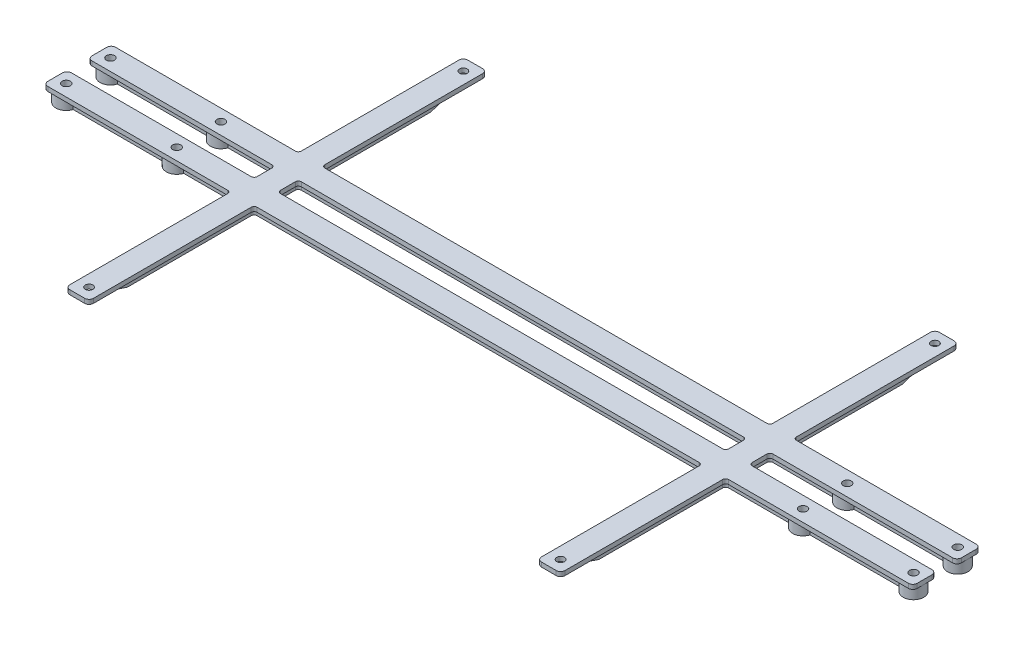
from build123d import *
from build123d.topology import SkipClean

# Parameters (mm, degrees)
EXTRUDE_1_DEPTH             = 2
SKETCH_3_W                  = 590
SKETCH_3_H                  = 3
EXTRUDE_3_DEPTH             = 8
SKETCH_4_R                  = 3.5
EXTRUDE_4_DEPTH             = 3
SKETCH_5_R                  = 3.5
EXTRUDE_5_DEPTH             = 3
FILLET_3_R                  = 3
SKETCH_6_R                  = 1.6
CUT_EXTRUDE_1_DEPTH         = 296.513536069
FILLET_4_R                  = 3
SKETCH_7_W                  = 8
SKETCH_7_H                  = 230
EXTRUDE_6_DEPTH             = 3
SKETCH_8_W                  = 4
SKETCH_8_H                  = 230
EXTRUDE_7_DEPTH             = 8
CUT_EXTRUDE_2_DEPTH         = 476.197853531
CUT_EXTRUDE_3_DEPTH         = 476.197853531
SKETCH_14_R                 = 2.6
CUT_EXTRUDE_6_DEPTH         = 323.56162202
MIRROR_7_COPY_1_SKETCH_R    = 2.6
MIRROR_7_COPY_1_DEPTH       = 323.56162202
SKETCH_16_R                 = 3
CUT_EXTRUDE_8_DEPTH         = 8
MIRROR_10_COPY_1_SKETCH_R   = 3
MIRROR_10_COPY_1_DEPTH      = 8
SKETCH_19_R                 = 2.6
CUT_EXTRUDE_11_DEPTH        = 48
MIRROR_12_COPY_1_SKETCH_R   = 2.6
MIRROR_12_COPY_1_DEPTH      = 48
SKETCH_20_W                 = 16
SKETCH_20_H                 = 3
EXTRUDE_9_DEPTH             = 20
MIRROR_14_COPY_1_SKETCH_W   = 16
MIRROR_14_COPY_1_SKETCH_H   = 3
MIRROR_14_COPY_1_DEPTH      = 20
SKETCH_21_R                 = 2.6
CUT_EXTRUDE_13_DEPTH        = 20
MIRROR_18_COPY_1_SKETCH_R   = 2.6
MIRROR_18_COPY_1_DEPTH      = 20
SKETCH_22_W                 = 304
SKETCH_22_H                 = 20.458635095
SKETCH_22_H_2               = 15.75983919
SKETCH_22_W_2               = 40.975841219
SKETCH_22_H_3               = 20.632120514
SKETCH_22_W_3               = 38.050492137
SKETCH_22_H_4               = 24.245894183
CUT_EXTRUDE_14_DEPTH        = 332.04229337
FILLET_14_R                 = 3
FILLET_15_R                 = 2
FILLET_16_R                 = 2
EXTRUDE_START               = -8
SKETCH_23_R                 = 7
SKETCH_23_R_2               = 2.6
EXTRUDE_10_DEPTH            = 8
CUT_EXTRUDE_START           = -8
CUT_EXTRUDE_15_DEPTH        = 8
PATTERN_LINEAR_1_COUNT      = 2
PATTERN_LINEAR_1_PITCH      = 75
MIRROR_START                = -8
MIRROR_19_COPY_1_SKETCH_R   = 7
MIRROR_19_COPY_1_SKETCH_R_2 = 2.6
MIRROR_19_COPY_1_DEPTH      = 8
MIRROR_20_COPY_1_SKETCH_R   = 7
MIRROR_20_COPY_1_SKETCH_R_2 = 2.6
MIRROR_20_COPY_1_DEPTH      = 8
MIRROR_20_COPY_2_SKETCH_R   = 7
MIRROR_20_COPY_2_SKETCH_R_2 = 2.6
MIRROR_20_COPY_2_DEPTH      = 8
MIRROR_20_COPY_3_DEPTH      = 8
MIRROR_20_COPY_4_SKETCH_R   = 7
MIRROR_20_COPY_4_SKETCH_R_2 = 2.6
MIRROR_20_COPY_4_DEPTH      = 8
HOLE_WIZARD_1_AT_2_COUNT    = 2
HOLE_WIZARD_1_AT_2_PITCH    = 75
HOLE_WIZARD_1_AT_3_COUNT    = 2
HOLE_WIZARD_1_AT_3_PITCH    = 80.777472107
HOLE_WIZARD_1_AT_4_COUNT    = 2
HOLE_WIZARD_1_AT_4_PITCH    = 30


with BuildPart() as part:
    # 草图1 → 凸台-拉伸1 (new, symmetric)
    with BuildSketch(Plane.XY):
        Polygon((-295, 0), (295, 0), (295, -3), (285, -8), (-285, -8), (-295, -3), align=None)
    extrude_1 = extrude(amount=EXTRUDE_1_DEPTH, both=True)

    # 草图3 → 凸台-拉伸3 (add, symmetric)
    with BuildSketch(Plane.XY):
        with Locations((0, 1.5)):
            Rectangle(SKETCH_3_W, SKETCH_3_H)
    extrude_3 = extrude(amount=EXTRUDE_3_DEPTH, both=True)

    # 草图4 → 凸台-拉伸4 (add)
    with BuildSketch(Plane(origin=(0, 3, 0), x_dir=(1, 0, 0), z_dir=(0, 1, 0))):
        with Locations((275, 10)):
            Circle(SKETCH_4_R)
        with Locations((275, -10)):
            Circle(SKETCH_4_R)
        with Locations((-275, -10)):
            Circle(SKETCH_4_R)
        with Locations((-275, 10)):
            Circle(SKETCH_4_R)
    extrude_4 = extrude(amount=-EXTRUDE_4_DEPTH)

    # 草图5 → 凸台-拉伸5 (add)
    with BuildSketch(Plane(origin=(0, 3, 0), x_dir=(1, 0, 0), z_dir=(0, 1, 0))):
        with Locations((140, 10)):
            Circle(SKETCH_5_R)
        with Locations((-140, 10)):
            Circle(SKETCH_5_R)
    extrude_5 = extrude(amount=-EXTRUDE_5_DEPTH)

    # 圆角3
    fillet_3_edges = [part.edges().sort_by_distance(p)[0] for p in [
        (142.872281323, 1.5, -8),
        (137.127718677, 1.5, -8),
        (-137.127718677, 1.5, -8),
        (-142.872281323, 1.5, -8),
    ]]
    fillet(fillet_3_edges, radius=FILLET_3_R)

    # 草图6 → 切除-拉伸1 (cut, through all)
    with BuildSketch(Plane(origin=(0, 3, 0), x_dir=(1, 0, 0), z_dir=(0, 1, 0))):
        with Locations(Location((275, 10, 0), (0, 0, 180))):
            Circle(SKETCH_6_R)
        with Locations(Location((275, -10, 0), (0, 0, 180))):
            Circle(SKETCH_6_R)
        with Locations(Location((140, 10, 0), (0, 0, 180))):
            Circle(SKETCH_6_R)
        with Locations((140, -10)):
            Circle(SKETCH_6_R)
        with Locations(Location((-140, 10, 0), (0, 0, 180))):
            Circle(SKETCH_6_R)
        with Locations((-140, -10)):
            Circle(SKETCH_6_R)
        with Locations(Location((-275, 10, 0), (0, 0, 180))):
            Circle(SKETCH_6_R)
        with Locations(Location((-275, -10, 0), (0, 0, 180))):
            Circle(SKETCH_6_R)
    cut_extrude_1 = extrude(amount=-CUT_EXTRUDE_1_DEPTH, mode=Mode.SUBTRACT)

    # 圆角4
    fillet_4_edges = [part.edges().sort_by_distance(p)[0] for p in [
        (295, 1.5, -8),
        (-295, 1.5, -8),
        (295, 1.5, 8),
        (-295, 1.5, 8),
    ]]
    fillet(fillet_4_edges, radius=FILLET_4_R)

    # 草图7 → 凸台-拉伸6 (add)
    with BuildSketch(Plane(origin=(0, 0, 0), x_dir=(1, 0, 0), z_dir=(0, 1, 0))):
        with Locations((-156, -15)):
            Rectangle(SKETCH_7_W, SKETCH_7_H)
        with Locations((-164, -15)):
            Rectangle(SKETCH_7_W, SKETCH_7_H)
    extrude_6 = extrude(amount=EXTRUDE_6_DEPTH)

    # 镜向1: 凸台-拉伸3, 凸台-拉伸4, 凸台-拉伸5, 切除-拉伸1 across plane
    add(extrude_3.mirror(Plane.XY.offset(15)))
    add(extrude_4.mirror(Plane.XY.offset(15)))
    add(extrude_5.mirror(Plane.XY.offset(15)))
    add(cut_extrude_1.mirror(Plane.XY.offset(15)), mode=Mode.SUBTRACT)

    # 镜向2: 凸台-拉伸1 across plane
    add(extrude_1.mirror(Plane.XY.offset(15)))

    # 草图8 → 凸台-拉伸7 (add)
    with BuildSketch(Plane.XZ):
        with Locations((-160, 15)):
            Rectangle(SKETCH_8_W, SKETCH_8_H)
    extrude_7 = extrude(amount=EXTRUDE_7_DEPTH)

    # 草图9 → 切除-拉伸2 (cut, through all)
    with BuildSketch(Plane.ZY.offset(162)):
        Polygon((130, -4), (118, -8), (130, -8), align=None)
    extrude(amount=-CUT_EXTRUDE_2_DEPTH, mode=Mode.SUBTRACT)

    # 镜向3: 凸台-拉伸6, 凸台-拉伸7 across plane
    add(extrude_6.mirror(Plane(origin=(0, 0, 0), x_dir=(0, 0, 1), z_dir=(1, 0, 0))))
    add(extrude_7.mirror(Plane(origin=(0, 0, 0), x_dir=(0, 0, 1), z_dir=(1, 0, 0))))

    # 草图11 → 切除-拉伸3 (cut, through all)
    with BuildSketch(Plane.ZY.offset(162)):
        Polygon((118, -8), (130, -4), (130, -8), align=None)
        Polygon((-100, -8), (-88, -8), (-100, -4), align=None)
    extrude(amount=-CUT_EXTRUDE_3_DEPTH, mode=Mode.SUBTRACT)

    # 草图14 → 切除-拉伸6 (cut, through all)
    with BuildSketch(Plane(origin=(0, 3, 0), x_dir=(1, 0, 0), z_dir=(0, 1, 0))):
        with Locations(Location((287.5, 0, 0), (0, 0, 180))):
            Circle(SKETCH_14_R)
    cut_extrude_6 = extrude(amount=-CUT_EXTRUDE_6_DEPTH, mode=Mode.SUBTRACT)

    # 镜向6: 切除-拉伸6 across plane
    add(cut_extrude_6.mirror(Plane.XY.offset(15)), mode=Mode.SUBTRACT)

    # 镜向7: 切除-拉伸6 across plane
    add(cut_extrude_6.mirror(Plane(origin=(0, 0, 0), x_dir=(0, 0, 1), z_dir=(1, 0, 0))), mode=Mode.SUBTRACT)

    # 镜向7 copy 1 sketch → 镜向7 copy 1 (cut, through all)
    with BuildSketch(Plane(origin=(0, 3, 30), x_dir=(-1, 0, 0), z_dir=(0, 1, 0))):
        with Locations(Location((287.5, 0, 0), (0, 0, 180))):
            Circle(MIRROR_7_COPY_1_SKETCH_R)
    extrude(amount=-MIRROR_7_COPY_1_DEPTH, mode=Mode.SUBTRACT)

    # 草图16 → 切除-拉伸8 (cut)
    with BuildSketch(Plane.XZ.offset(8)):
        with Locations((-212.5, 0)):
            Circle(SKETCH_16_R)
    cut_extrude_8 = extrude(amount=-CUT_EXTRUDE_8_DEPTH, mode=Mode.SUBTRACT)

    # 镜向9: 切除-拉伸8 across plane
    add(cut_extrude_8.mirror(Plane.XY.offset(15)), mode=Mode.SUBTRACT)

    # 镜向10: 切除-拉伸8 across plane
    add(cut_extrude_8.mirror(Plane(origin=(0, 0, 0), x_dir=(0, 0, 1), z_dir=(1, 0, 0))), mode=Mode.SUBTRACT)

    # 镜向10 copy 1 sketch → 镜向10 copy 1 (cut)
    with BuildSketch(Plane(origin=(0, -8, 30), x_dir=(-1, 0, 0), z_dir=(0, -1, 0))):
        with Locations((-212.5, 0)):
            Circle(MIRROR_10_COPY_1_SKETCH_R)
    extrude(amount=-MIRROR_10_COPY_1_DEPTH, mode=Mode.SUBTRACT)

    # 草图19 → 切除-拉伸11 (cut)
    with BuildSketch(Plane.XZ):
        with Locations((212.5, 30)):
            Circle(SKETCH_19_R)
    cut_extrude_11 = extrude(amount=-CUT_EXTRUDE_11_DEPTH, mode=Mode.SUBTRACT)

    # 镜向11: 切除-拉伸11 across plane
    add(cut_extrude_11.mirror(Plane.XY.offset(15)), mode=Mode.SUBTRACT)

    # 镜向12: 切除-拉伸11 across plane
    add(cut_extrude_11.mirror(Plane(origin=(0, 0, 0), x_dir=(0, 0, 1), z_dir=(1, 0, 0))), mode=Mode.SUBTRACT)

    # 镜向12 copy 1 sketch → 镜向12 copy 1 (cut)
    with BuildSketch(Plane(origin=(0, 0, 30), x_dir=(-1, 0, 0), z_dir=(0, -1, 0))):
        with Locations((212.5, 30)):
            Circle(MIRROR_12_COPY_1_SKETCH_R)
    extrude(amount=-MIRROR_12_COPY_1_DEPTH, mode=Mode.SUBTRACT)

    # 草图20 → 凸台-拉伸9 (add)
    with BuildSketch(Plane.XY.offset(130)):
        with Locations((-160, 1.5)):
            Rectangle(SKETCH_20_W, SKETCH_20_H)
    extrude_9 = extrude(amount=EXTRUDE_9_DEPTH)

    # 镜向13: 凸台-拉伸9 across plane
    add(extrude_9.mirror(Plane(origin=(0, 0, 0), x_dir=(0, 0, 1), z_dir=(1, 0, 0))))

    # 镜向14: 凸台-拉伸9 across plane
    add(extrude_9.mirror(Plane.XY.offset(15)))

    # 镜向14 copy 1 sketch → 镜向14 copy 1 (add)
    with BuildSketch(Plane(origin=(0, 0, -100), x_dir=(-1, 0, 0), z_dir=(0, 0, -1))):
        with Locations((-160, 1.5)):
            Rectangle(MIRROR_14_COPY_1_SKETCH_W, MIRROR_14_COPY_1_SKETCH_H)
    extrude(amount=MIRROR_14_COPY_1_DEPTH)

    # 草图21 → 切除-拉伸13 (cut)
    with BuildSketch(Plane.XZ):
        with Locations((-160, 142)):
            Circle(SKETCH_21_R)
    cut_extrude_13 = extrude(amount=-CUT_EXTRUDE_13_DEPTH, mode=Mode.SUBTRACT)

    # 镜向17: 切除-拉伸13 across plane
    add(cut_extrude_13.mirror(Plane(origin=(0, 0, 0), x_dir=(0, 0, 1), z_dir=(1, 0, 0))), mode=Mode.SUBTRACT)

    # 镜向18: 切除-拉伸13 across plane
    add(cut_extrude_13.mirror(Plane.XY.offset(15)), mode=Mode.SUBTRACT)

    # 镜向18 copy 1 sketch → 镜向18 copy 1 (cut)
    with BuildSketch(Plane(origin=(0, 0, 30), x_dir=(-1, 0, 0), z_dir=(0, -1, 0))):
        with Locations((-160, 142)):
            Circle(MIRROR_18_COPY_1_SKETCH_R)
    extrude(amount=-MIRROR_18_COPY_1_DEPTH, mode=Mode.SUBTRACT)

    # 草图22 → 切除-拉伸14 (cut, through all)
    with BuildSketch(Plane.XZ):
        with Locations((0, -18.229317548)):
            Rectangle(SKETCH_22_W, SKETCH_22_H)
        with Locations((0, 45.879919595)):
            Rectangle(SKETCH_22_W, SKETCH_22_H_2)
        with Locations((-274.51207939, 48.316060257)):
            Rectangle(SKETCH_22_W_2, SKETCH_22_H_3)
        Polygon((-289.685252837, -8), (-263.176120972, -8), (-265.069630391, -21.546038758), (-289.685252837, -21.546038758), align=None)
        with Locations((272.328766292, 50.122947092)):
            Rectangle(SKETCH_22_W_3, SKETCH_22_H_4)
        Polygon((256.093889646, -8), (256.093889646, -25.523907681), (293.383371941, -25.523907681), (292, -8), align=None)
        Polygon((265.505915961, 22), (288.132963779, 22), (288.132963779, 8), (263.939428036, 8), align=None)
        Polygon((-261.312059462, 22), (-287.701596489, 22), (-287.701596489, 8), (-262.51579273, 8), align=None)
    extrude(amount=-CUT_EXTRUDE_14_DEPTH, mode=Mode.SUBTRACT)

    # 圆角14
    fillet_14_edges = [part.edges().sort_by_distance(p)[0] for p in [
        (-295, 1.5, 38),
        (-295, 1.5, 22),
        (295, 1.5, 22),
        (295, 1.5, 38),
        (-168, 1.5, 150),
        (-152, 1.5, 150),
        (168, 1.5, 150),
        (152, 1.5, 150),
        (168, 1.5, -120),
        (152, 1.5, -120),
        (-168, 1.5, -120),
        (-152, 1.5, -120),
    ]]
    fillet(fillet_14_edges, radius=FILLET_14_R)

    # 圆角15
    fillet_15_edges = [part.edges().sort_by_distance(p)[0] for p in [
        (152, 1.5, 38),
        (152, 1.5, 22),
        (152, 1.5, -8),
        (152, 1.5, 8),
        (168, 1.5, 38),
        (168, 1.5, -8),
        (168, 1.5, 22),
        (168, 1.5, 8),
        (158, -4, -2),
        (158, -4, 32),
        (162, -4, -2),
        (162, -4, 32),
        (158, -4, 2),
        (158, -4, 28),
        (162, -4, 2),
        (162, -4, 28),
    ]]
    fillet(fillet_15_edges, radius=FILLET_15_R)

    # 圆角16
    fillet_16_edges = [part.edges().sort_by_distance(p)[0] for p in [
        (-168, 1.5, -8),
        (-168, 1.5, 8),
        (-152, 1.5, -8),
        (-152, 1.5, 8),
        (-168, 1.5, 38),
        (-168, 1.5, 22),
        (-152, 1.5, 38),
        (-152, 1.5, 22),
        (-158, -4, 32),
        (-162, -4, 32),
        (-162, -4, 2),
        (-162, -4, -2),
        (-162, -4, 28),
        (-158, -4, 2),
        (-158, -4, -2),
        (-158, -4, 28),
    ]]
    fillet(fillet_16_edges, radius=FILLET_16_R)

    # 草图23 → 凸台-拉伸10 (add)
    with BuildSketch(Plane.XZ.offset(8).offset(EXTRUDE_START)):
        with Locations((-287.5, 30)):
            Circle(SKETCH_23_R)
        with Locations((-287.5, 30)):
            Circle(SKETCH_23_R_2, mode=Mode.SUBTRACT)
    extrude_10 = extrude(amount=EXTRUDE_10_DEPTH)

    # 草图24 → 切除-拉伸15 (cut)
    with SkipClean():  # the faces are left unmerged after this step: merging them gives an invalid solid
        with BuildSketch(Plane.XZ.offset(8).offset(CUT_EXTRUDE_START)):
            with BuildLine():
                ThreePointArc((-292.398979486, 25), (-294.5, 30), (-292.398979486, 35))
                Line((-292.398979486, 35), (-299.1152883, 35))
                Line((-299.1152883, 35), (-299.1152883, 25))
                Line((-299.1152883, 25), (-292.398979486, 25))
            make_face()
        cut_extrude_15 = extrude(amount=CUT_EXTRUDE_15_DEPTH, mode=Mode.SUBTRACT)

    # 阵列(线性)1: 凸台-拉伸10 ×2
    with Locations(*[(i * PATTERN_LINEAR_1_PITCH, 0, 0) for i in range(1, PATTERN_LINEAR_1_COUNT)]):
        add(extrude_10)

    # 镜向19: 凸台-拉伸10, 切除-拉伸15 across plane
    with SkipClean():  # the faces are left unmerged after this step: merging them gives an invalid solid
        add(extrude_10.mirror(Plane.XY.offset(15)))
        add(cut_extrude_15.mirror(Plane.XY.offset(15)), mode=Mode.SUBTRACT)

    # 镜向19 copy 1 sketch → 镜向19 copy 1 (add)
    with SkipClean():  # the faces are left unmerged after this step: merging them gives an invalid solid
        with BuildSketch(Plane(origin=(75, -8, 30), x_dir=(1, 0, 0), z_dir=(0, -1, 0)).offset(MIRROR_START)):
            with Locations((-287.5, -30)):
                Circle(MIRROR_19_COPY_1_SKETCH_R)
            with Locations((-287.5, -30)):
                Circle(MIRROR_19_COPY_1_SKETCH_R_2, mode=Mode.SUBTRACT)
        extrude(amount=MIRROR_19_COPY_1_DEPTH)

    # 镜向20: 凸台-拉伸10, 切除-拉伸15 across plane
    with SkipClean():  # the faces are left unmerged after this step: merging them gives an invalid solid
        add(extrude_10.mirror(Plane(origin=(0, 0, 0), x_dir=(0, 0, 1), z_dir=(1, 0, 0))))
        add(cut_extrude_15.mirror(Plane(origin=(0, 0, 0), x_dir=(0, 0, 1), z_dir=(1, 0, 0))), mode=Mode.SUBTRACT)

    # 镜向20 copy 1 sketch → 镜向20 copy 1 (add)
    with SkipClean():  # the faces are left unmerged after this step: merging them gives an invalid solid
        with BuildSketch(Plane(origin=(-75, -8, 0), x_dir=(-1, 0, 0), z_dir=(0, -1, 0)).offset(MIRROR_START)):
            with Locations((-287.5, -30)):
                Circle(MIRROR_20_COPY_1_SKETCH_R)
            with Locations((-287.5, -30)):
                Circle(MIRROR_20_COPY_1_SKETCH_R_2, mode=Mode.SUBTRACT)
        extrude(amount=MIRROR_20_COPY_1_DEPTH)

    # 镜向20 copy 2 sketch → 镜向20 copy 2 (add)
    with SkipClean():  # the faces are left unmerged after this step: merging them gives an invalid solid
        with BuildSketch(Plane(origin=(0, -8, 30), x_dir=(-1, 0, 0), z_dir=(0, -1, 0)).offset(MIRROR_START)):
            with Locations((-287.5, 30)):
                Circle(MIRROR_20_COPY_2_SKETCH_R)
            with Locations((-287.5, 30)):
                Circle(MIRROR_20_COPY_2_SKETCH_R_2, mode=Mode.SUBTRACT)
        extrude(amount=MIRROR_20_COPY_2_DEPTH)

    # 镜向20 copy 3 sketch → 镜向20 copy 3 (cut)
    with SkipClean():  # the faces are left unmerged after this step: merging them gives an invalid solid
        with BuildSketch(Plane(origin=(0, -8, 30), x_dir=(-1, 0, 0), z_dir=(0, -1, 0)).offset(MIRROR_START)):
            with BuildLine():
                ThreePointArc((-292.398979486, 25), (-294.5, 30), (-292.398979486, 35))
                Line((-292.398979486, 35), (-299.1152883, 35))
                Line((-299.1152883, 35), (-299.1152883, 25))
                Line((-299.1152883, 25), (-292.398979486, 25))
            make_face()
        extrude(amount=MIRROR_20_COPY_3_DEPTH, mode=Mode.SUBTRACT)

    # 镜向20 copy 4 sketch → 镜向20 copy 4 (add)
    with SkipClean():  # the faces are left unmerged after this step: merging them gives an invalid solid
        with BuildSketch(Plane(origin=(-75, -8, 30), x_dir=(-1, 0, 0), z_dir=(0, -1, 0)).offset(MIRROR_START)):
            with Locations((-287.5, 30)):
                Circle(MIRROR_20_COPY_4_SKETCH_R)
            with Locations((-287.5, 30)):
                Circle(MIRROR_20_COPY_4_SKETCH_R_2, mode=Mode.SUBTRACT)
        extrude(amount=MIRROR_20_COPY_4_DEPTH)

    # 草图25 → 打孔尺寸(%根据)内六角圆柱头螺钉的类型1 (revolve, cut)
    with SkipClean():  # the faces are left unmerged after this step: merging them gives an invalid solid
        with BuildSketch(Plane(origin=(-287.5, -8, 30), x_dir=(0, 0, -1), z_dir=(1, 0, 0))):
            Polygon((0, 0), (0, 21.652366702), (2.75, 20), (2.75, 5.7), (5, 5.7), (5, 0), align=None)
        hole_wizard_1 = revolve(axis=Axis((-287.5, -14.35, 30), (0, 1, 0)), mode=Mode.SUBTRACT)

    # 打孔尺寸(%根据)内六角圆柱头螺钉的类型1 at 2: 打孔尺寸(%根据)内六角圆柱头螺钉的类型1 ×2
    with SkipClean():  # the faces are left unmerged after this step: merging them gives an invalid solid
        with Locations(*[(i * HOLE_WIZARD_1_AT_2_PITCH, 0, 0) for i in range(1, HOLE_WIZARD_1_AT_2_COUNT)]):
            add(hole_wizard_1, mode=Mode.SUBTRACT)

    # 打孔尺寸(%根据)内六角圆柱头螺钉的类型1 at 3: 打孔尺寸(%根据)内六角圆柱头螺钉的类型1 ×2
    with SkipClean():  # the faces are left unmerged after this step: merging them gives an invalid solid
        with Locations(*[Vector(0.9284766908852594, 0, -0.3713906763541036) * (i * HOLE_WIZARD_1_AT_3_PITCH) for i in range(1, HOLE_WIZARD_1_AT_3_COUNT)]):
            add(hole_wizard_1, mode=Mode.SUBTRACT)

    # 打孔尺寸(%根据)内六角圆柱头螺钉的类型1 at 4: 打孔尺寸(%根据)内六角圆柱头螺钉的类型1 ×2
    with SkipClean():  # the faces are left unmerged after this step: merging them gives an invalid solid
        with Locations(*[(0, 0, -i * HOLE_WIZARD_1_AT_4_PITCH) for i in range(1, HOLE_WIZARD_1_AT_4_COUNT)]):
            add(hole_wizard_1, mode=Mode.SUBTRACT)

    # 镜向21: 打孔尺寸(%根据)内六角圆柱头螺钉的类型1 across plane
    with SkipClean():  # the faces are left unmerged after this step: merging them gives an invalid solid
        add(hole_wizard_1.mirror(Plane(origin=(0, 0, 0), x_dir=(0, 0, 1), z_dir=(1, 0, 0))), mode=Mode.SUBTRACT)

    # 镜向21 copy 1 sketch → 镜向21 copy 1 (revolve, cut)
    with SkipClean():  # the faces are left unmerged after this step: merging them gives an invalid solid
        with BuildSketch(Plane(origin=(212.5, -8, 30), x_dir=(0, 0, -1), z_dir=(-1, 0, 0))):
            Polygon((0, 0), (0, -21.652366702), (2.75, -20), (2.75, -5.7), (5, -5.7), (5, 0), align=None)
        revolve(axis=Axis((212.5, -14.35, 30), (0, -1, 0)), mode=Mode.SUBTRACT)

    # 镜向21 copy 2 sketch → 镜向21 copy 2 (revolve, cut)
    with SkipClean():  # the faces are left unmerged after this step: merging them gives an invalid solid
        with BuildSketch(Plane(origin=(212.5, -8, 0), x_dir=(0, 0, -1), z_dir=(-1, 0, 0))):
            Polygon((0, 0), (0, -21.652366702), (2.75, -20), (2.75, -5.7), (5, -5.7), (5, 0), align=None)
        revolve(axis=Axis((212.5, -14.35, 0), (0, -1, 0)), mode=Mode.SUBTRACT)

    # 镜向21 copy 3 sketch → 镜向21 copy 3 (revolve, cut)
    with SkipClean():  # the faces are left unmerged after this step: merging them gives an invalid solid
        with BuildSketch(Plane(origin=(287.5, -8, 0), x_dir=(0, 0, -1), z_dir=(-1, 0, 0))):
            Polygon((0, 0), (0, -21.652366702), (2.75, -20), (2.75, -5.7), (5, -5.7), (5, 0), align=None)
        revolve(axis=Axis((287.5, -14.35, 0), (0, -1, 0)), mode=Mode.SUBTRACT)


solid = part.part
